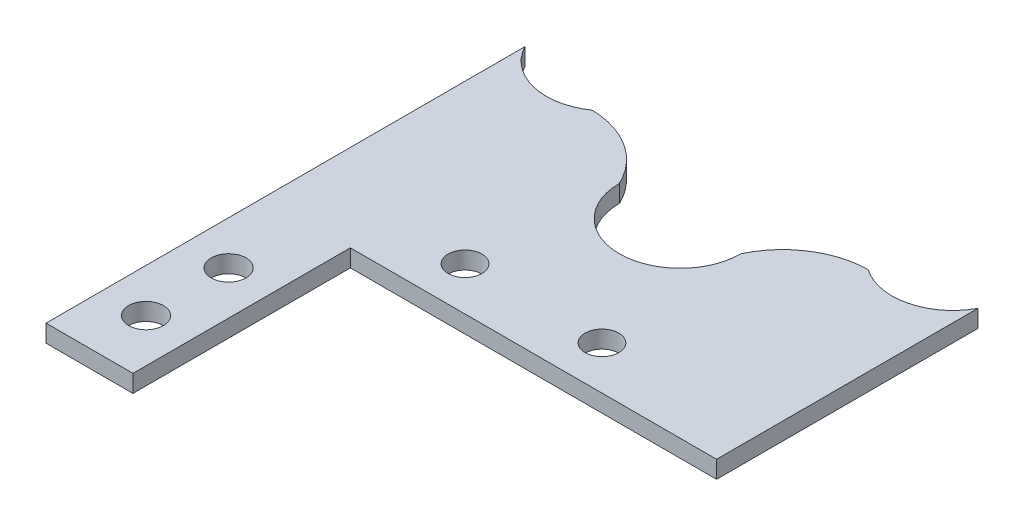
from build123d import *

# Parameters (mm, degrees)
BASE_FLANGE1_DEPTH = 2
SKETCH7_R          = 2
CUT_EXTRUDE1_DEPTH = 2
SKETCH9_R          = 1.9431
CUT_EXTRUDE2_DEPTH = 2


# Sheet-metal steps are written as plain solids
with BuildPart() as part:
    # Sketch2 → Base-Flange1 (new body)
    with BuildSketch(Plane(origin=(0, 0, 0), x_dir=(1, 0, 0), z_dir=(0, 1, 0))):
        with BuildLine():
            Line((-26.055569119, -21.875), (-26.055569119, -46.875))
            Line((-26.055569119, -46.875), (-16.055569119, -46.875))
            Line((-16.055569119, -46.875), (-16.055569119, -21.875))
            Line((-16.055569119, -21.875), (26.055569119, -21.875))
            Line((26.055569119, -21.875), (26.055569119, 8.188046441))
            ThreePointArc((26.055569119, 8.188046441), (21.514872246, 4.669726518), (15.870079226, 5.73406431))
            ThreePointArc((15.870079226, 5.73406431), (10.616247764, 4.133629141), (7, 0))
            ThreePointArc((7, 0), (0, -7), (-7, 0))
            ThreePointArc((-7, 0), (-10.616247764, 4.133629141), (-15.870079226, 5.73406431))
            ThreePointArc((-15.870079226, 5.73406431), (-21.514872246, 4.669726518), (-26.055569119, 8.188046441))
            Line((-26.055569119, 8.188046441), (-26.055569119, -21.875))
        make_face()
    extrude(amount=-BASE_FLANGE1_DEPTH)

    # Sketch7 → Cut-Extrude1 (cut)
    with BuildSketch(Plane(origin=(0, 0, 0), x_dir=(1, 0, 0), z_dir=(0, 1, 0))):
        with Locations(Location((-21.055569119, -40.375, 0), (0, 0, 270))):
            Circle(SKETCH7_R)
        with Locations(Location((-21.055569119, -30.875, 0), (0, 0, 270))):
            Circle(SKETCH7_R)
    extrude(amount=-CUT_EXTRUDE1_DEPTH, mode=Mode.SUBTRACT)

    # Sketch9 → Cut-Extrude2 (cut)
    with BuildSketch(Plane(origin=(0, 0, 0), x_dir=(1, 0, 0), z_dir=(0, 1, 0))):
        with Locations(Location((-7.875283017, -16.875, 0), (0, 0, 270))):
            Circle(SKETCH9_R)
        with Locations(Location((7.875283017, -16.875, 0), (0, 0, 270))):
            Circle(SKETCH9_R)
    extrude(amount=-CUT_EXTRUDE2_DEPTH, mode=Mode.SUBTRACT)


solid = part.part
